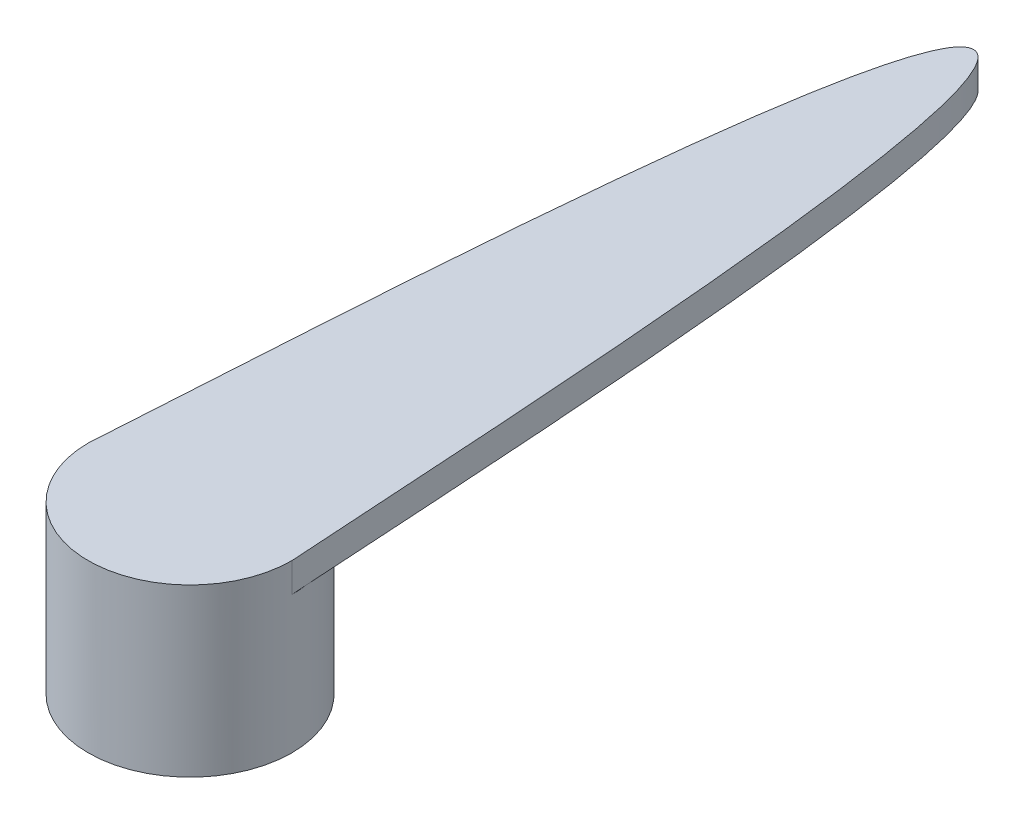
from build123d import *

# Parameters (mm, degrees)
SCHIZZO1_R                   = 5.2
ESTRUSIONE_ESTRUSIONE1_DEPTH = 6
SCHIZZO2_R                   = 5.2
ESTRUSIONE_ESTRUSIONE2_DEPTH = 1
ESTRUSIONE_ESTRUSIONE3_DEPTH = 1.5


with BuildPart() as part:
    # Schizzo1 → Estrusione-Estrusione1 (new body)
    with BuildSketch(Plane(origin=(0, 0, 0), x_dir=(1, 0, 0), z_dir=(0, 1, 0))):
        Circle(SCHIZZO1_R)
        with BuildLine():
            Line((-1.6, -1.652271164), (-1.6, 1.652271164))
            ThreePointArc((-1.6, 1.652271164), (2.3, 0), (-1.6, -1.652271164))
        make_face(mode=Mode.SUBTRACT)
    extrude(amount=ESTRUSIONE_ESTRUSIONE1_DEPTH)

    # Schizzo2 → Estrusione-Estrusione2 (add)
    with BuildSketch(Plane(origin=(0, 6, 0), x_dir=(1, 0, 0), z_dir=(0, 1, 0))):
        Circle(SCHIZZO2_R)
    extrude(amount=ESTRUSIONE_ESTRUSIONE2_DEPTH)

    # Schizzo4 → Estrusione-Estrusione3 (add)
    with BuildSketch(Plane(origin=(0, 7, 0), x_dir=(1, 0, 0), z_dir=(0, 1, 0))):
        with BuildLine():
            ThreePointArc((5.2, 0), (0, -5.2), (-5.2, 0))
            add(Edge.make_bspline(
                [(-5.2, 0), (-4.706569927, 6.686332962), (-3.231143792, 40), (0, 40)],
                knots=[0, 0, 0, 0, 1, 1, 1, 1], degree=3))
            add(Edge.make_bspline(
                [(5.2, 0), (4.706569927, 6.686332962), (3.231143792, 40), (0, 40)],
                knots=[0, 0, 0, 0, 1, 1, 1, 1], degree=3))
        make_face()
    extrude(amount=ESTRUSIONE_ESTRUSIONE3_DEPTH)


solid = part.part
